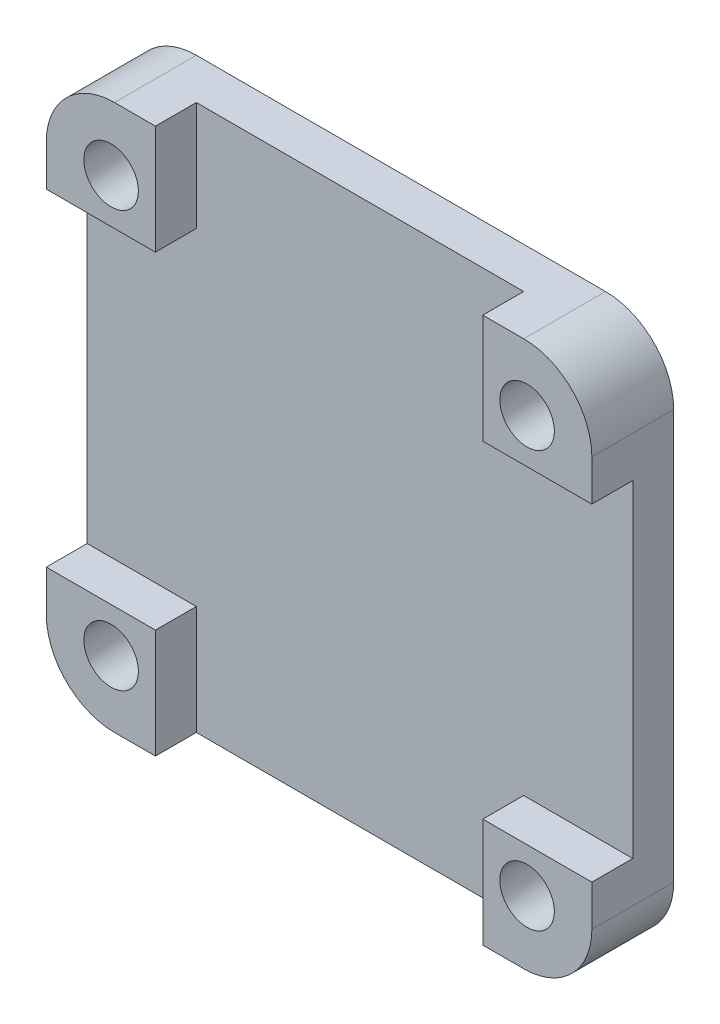
from build123d import *

# Parameters (mm, degrees)
SKETCH_1_R      = 2
EXTRUDE_1_DEPTH = 3
SKETCH_2_R      = 2
EXTRUDE_2_DEPTH = 3
SKETCH_3_W      = 1.5
SKETCH_3_H      = 20
EXTRUDE_4_DEPTH = 3
SKETCH_5_W      = 1.5
SKETCH_5_H      = 20
REVOLVE_2_ANGLE = 90
SKETCH_6_W      = 1.5
SKETCH_6_H      = 20
EXTRUDE_5_DEPTH = 5
SKETCH_8_W      = 1.5
SKETCH_8_H      = 20
REVOLVE_3_ANGLE = 90
SKETCH_9_W      = 1.5
SKETCH_9_H      = 20
EXTRUDE_6_DEPTH = 5


with BuildPart() as part:
    # 草图1 → 凸台-拉伸1 (new body)
    with BuildSketch(Plane.XY):
        with BuildLine():
            Line((-15, 20), (15, 20))
            ThreePointArc((15, 20), (18.535533906, 18.535533906), (20, 15))
            Line((20, 15), (20, -15))
            ThreePointArc((20, -15), (18.535533906, -18.535533906), (15, -20))
            Line((15, -20), (-15, -20))
            ThreePointArc((-15, -20), (-18.535533906, -18.535533906), (-20, -15))
            Line((-20, -15), (-20, 15))
            ThreePointArc((-20, 15), (-18.535533906, 18.535533906), (-15, 20))
        make_face()
        with Locations((-15.25, 15.25)):
            Circle(SKETCH_1_R, mode=Mode.SUBTRACT)
        with Locations((15.25, 15.25)):
            Circle(SKETCH_1_R, mode=Mode.SUBTRACT)
        with Locations((15.25, -15.25)):
            Circle(SKETCH_1_R, mode=Mode.SUBTRACT)
        with Locations((-15.25, -15.25)):
            Circle(SKETCH_1_R, mode=Mode.SUBTRACT)
    extrude(amount=EXTRUDE_1_DEPTH)

    # 草图2 → 凸台-拉伸2 (add)
    # profile 1 of 4: a face of its own
    with BuildSketch(Plane.XY.offset(3)):
        with BuildLine():
            Line((-20, 15), (-20, 12))
            Line((-20, 12), (-12, 12))
            Line((-12, 12), (-12, 20))
            Line((-12, 20), (-15, 20))
            ThreePointArc((-15, 20), (-18.535533906, 18.535533906), (-20, 15))
        make_face()
        with Locations((-15.25, 15.25)):
            Circle(SKETCH_2_R, mode=Mode.SUBTRACT)
    # profile 2 of 4: a face of its own
    with BuildSketch(Plane.XY.offset(3)):
        with BuildLine():
            Line((12, 20), (15, 20))
            ThreePointArc((15, 20), (18.535533906, 18.535533906), (20, 15))
            Line((20, 15), (20, 12))
            Line((20, 12), (12, 12))
            Line((12, 12), (12, 20))
        make_face()
        with Locations((15.25, 15.25)):
            Circle(SKETCH_2_R, mode=Mode.SUBTRACT)
    # profile 3 of 4: a face of its own
    with BuildSketch(Plane.XY.offset(3)):
        with BuildLine():
            Line((20, -15), (20, -12))
            Line((20, -12), (12, -12))
            Line((12, -12), (12, -20))
            Line((12, -20), (15, -20))
            ThreePointArc((15, -20), (18.535533906, -18.535533906), (20, -15))
        make_face()
        with Locations((15.25, -15.25)):
            Circle(SKETCH_2_R, mode=Mode.SUBTRACT)
    # profile 4 of 4: a face of its own
    with BuildSketch(Plane.XY.offset(3)):
        with BuildLine():
            Line((-12, -20), (-15, -20))
            ThreePointArc((-15, -20), (-18.535533906, -18.535533906), (-20, -15))
            Line((-20, -15), (-20, -12))
            Line((-20, -12), (-12, -12))
            Line((-12, -12), (-12, -20))
        make_face()
        with Locations((-15.25, -15.25)):
            Circle(SKETCH_2_R, mode=Mode.SUBTRACT)
    extrude(amount=EXTRUDE_2_DEPTH)

    # 草图3 → 凸台-拉伸4 (add)
    with BuildSketch(Plane(origin=(0, 0, 0), x_dir=(-1, 0, 0), z_dir=(0, 0, -1))):
        with Locations((-12.75, 0)):
            Rectangle(SKETCH_3_W, SKETCH_3_H)
        with Locations((12.75, 0)):
            Rectangle(SKETCH_3_W, SKETCH_3_H)
    extrude(amount=EXTRUDE_4_DEPTH)

    # 草图5 → 旋转2 (revolve)
    with BuildSketch(Plane(origin=(0, 0, -3), x_dir=(-1, 0, 0), z_dir=(0, 0, -1))):
        with Locations((-12.75, 0)):
            Rectangle(SKETCH_5_W, SKETCH_5_H)
    revolve(axis=Axis((12, 10, -3), (0, 1, 0)), revolution_arc=REVOLVE_2_ANGLE)

    # 草图6 → 凸台-拉伸5 (add)
    with BuildSketch(Plane.ZY.offset(-12)):
        with Locations((-3.75, 0)):
            Rectangle(SKETCH_6_W, SKETCH_6_H)
    extrude(amount=EXTRUDE_5_DEPTH)

    # 草图8 → 旋转3 (revolve)
    with BuildSketch(Plane(origin=(0, 0, -3), x_dir=(-1, 0, 0), z_dir=(0, 0, -1))):
        with Locations((12.75, 0)):
            Rectangle(SKETCH_8_W, SKETCH_8_H)
    revolve(axis=Axis((-12, 10, -3), (0, -1, 0)), revolution_arc=REVOLVE_3_ANGLE)

    # 草图9 → 凸台-拉伸6 (add)
    with BuildSketch(Plane(origin=(-12, 0, 0), x_dir=(0, 0, -1), z_dir=(1, 0, 0))):
        with Locations((3.75, 0)):
            Rectangle(SKETCH_9_W, SKETCH_9_H)
    extrude(amount=EXTRUDE_6_DEPTH)


solid = part.part
